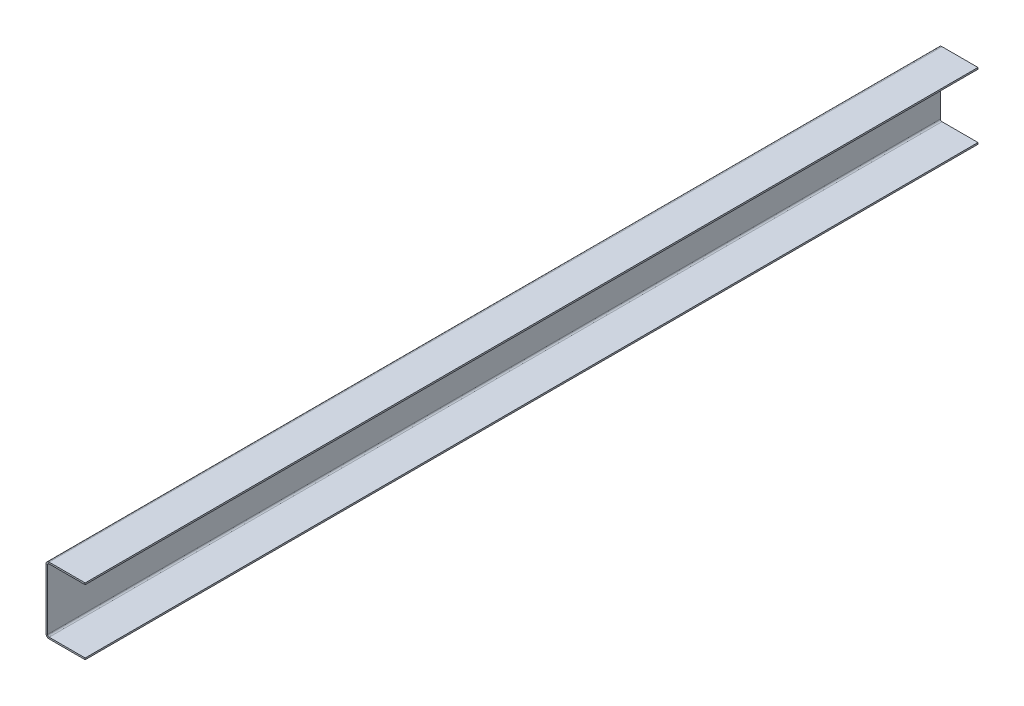
from build123d import *

# Parameters (mm, degrees)
BASE_FLANGE1_DEPTH = 1140


# Sheet-metal steps are written as plain solids
with BuildPart() as part:
    # Sketch1 → Base-Flange1 (new body)
    with BuildSketch(Plane.XY):
        with BuildLine():
            Line((50, 85), (4, 85))
            ThreePointArc((4, 85), (1.171572875, 83.828427125), (0, 81))
            Line((0, 81), (0, 4))
            ThreePointArc((0, 4), (1.171572875, 1.171572875), (4, 0))
            Line((4, 0), (50, 0))
            Line((50, 0), (50, 2))
            Line((50, 2), (4, 2))
            ThreePointArc((4, 2), (2.585786438, 2.585786438), (2, 4))
            Line((2, 4), (2, 81))
            ThreePointArc((2, 81), (2.585786438, 82.414213562), (4, 83))
            Line((4, 83), (50, 83))
            Line((50, 83), (50, 85))
        make_face()
    extrude(amount=BASE_FLANGE1_DEPTH)


solid = part.part
